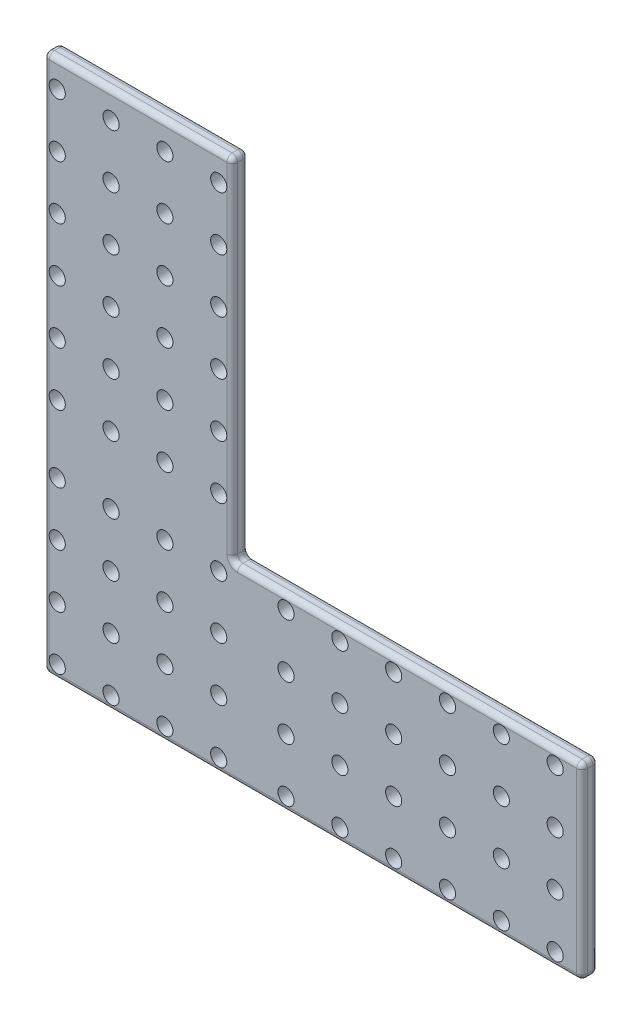
from build123d import *

# Parameters (mm, degrees)
ESQUISSE1_W                        = 100
ESQUISSE1_H                        = 35
BOSS_EXTRU_1_DEPTH                 = 3
ESQUISSE2_R                        = 1.5
ENL_V_MAT_EXTRU_1_DEPTH            = 3
CONG_1_R                           = 1
R_P_TITION_CIRCULAIRE4_COUNT       = 2
R_P_TITION_CIRCULAIRE4_ANGLE       = 90
R_P_TITION_CIRCULAIRE4_2_COUNT     = 2
R_P_TITION_CIRCULAIRE4_2_ANGLE     = 90
CONG_1_OF_R_P_TITION_CIRCULAIRE4_R = 1
ESQUISSE4_R                        = 1.5
ENL_V_MAT_EXTRU_2_DEPTH            = 10
CONG_2_R                           = 1


with BuildPart() as part:
    # Esquisse1 → Boss.-Extru.1 (new body)
    with BuildSketch(Plane.XY):
        with Locations((50, 17.5)):
            Rectangle(ESQUISSE1_W, ESQUISSE1_H)
    boss_extru_1 = extrude(amount=BOSS_EXTRU_1_DEPTH)

    # Esquisse2 → Enlèv. mat.-Extru.1 (cut)
    with BuildSketch(Plane.XY.offset(3)):
        with Locations((95, 32.5)):
            Circle(ESQUISSE2_R)
        with Locations((85, 32.5)):
            Circle(ESQUISSE2_R)
        with Locations((75, 32.5)):
            Circle(ESQUISSE2_R)
        with Locations((65, 32.5)):
            Circle(ESQUISSE2_R)
        with Locations((55, 32.5)):
            Circle(ESQUISSE2_R)
        with Locations((45, 32.5)):
            Circle(ESQUISSE2_R)
        with Locations((85, 22.5)):
            Circle(ESQUISSE2_R)
        with Locations((75, 22.5)):
            Circle(ESQUISSE2_R)
        with Locations((65, 22.5)):
            Circle(ESQUISSE2_R)
        with Locations((55, 22.5)):
            Circle(ESQUISSE2_R)
        with Locations((45, 22.5)):
            Circle(ESQUISSE2_R)
        with Locations((85, 12.5)):
            Circle(ESQUISSE2_R)
        with Locations((75, 12.5)):
            Circle(ESQUISSE2_R)
        with Locations((65, 12.5)):
            Circle(ESQUISSE2_R)
        with Locations((55, 12.5)):
            Circle(ESQUISSE2_R)
        with Locations((45, 12.5)):
            Circle(ESQUISSE2_R)
        with Locations((85, 2.5)):
            Circle(ESQUISSE2_R)
        with Locations((75, 2.5)):
            Circle(ESQUISSE2_R)
        with Locations((65, 2.5)):
            Circle(ESQUISSE2_R)
        with Locations((55, 2.5)):
            Circle(ESQUISSE2_R)
        with Locations((45, 2.5)):
            Circle(ESQUISSE2_R)
        with Locations((95, 22.5)):
            Circle(ESQUISSE2_R)
        with Locations((95, 12.5)):
            Circle(ESQUISSE2_R)
        with Locations((95, 2.5)):
            Circle(ESQUISSE2_R)
    enl_v_mat_extru_1 = extrude(amount=-ENL_V_MAT_EXTRU_1_DEPTH, mode=Mode.SUBTRACT)

    # Congé1
    cong_1_edges = [part.edges().sort_by_distance(p)[0] for p in [
        (0, 35, 1.5),
        (100, 35, 1.5),
        (100, 0, 1.5),
        (0, 0, 1.5),
    ]]
    fillet(cong_1_edges, radius=CONG_1_R)


with BuildPart() as r_p_tition_circulaire4_1:
    # Répétition circulaire4: Boss.-Extru.1 ×2 about axis
    r_p_tition_circulaire4_axis = Axis((17.5, 17.5, 0), (0, 0, 1))
    for i in range(1, R_P_TITION_CIRCULAIRE4_COUNT):
        add(boss_extru_1.rotate(r_p_tition_circulaire4_axis, i * R_P_TITION_CIRCULAIRE4_ANGLE / (R_P_TITION_CIRCULAIRE4_COUNT - 1)))

    # R_p_tition circulaire4 2: Enlèv. mat.-Extru.1 ×2 about axis
    r_p_tition_circulaire4_2_axis = Axis((17.5, 17.5, 0), (0, 0, 1))
    for i in range(1, R_P_TITION_CIRCULAIRE4_2_COUNT):
        add(enl_v_mat_extru_1.rotate(r_p_tition_circulaire4_2_axis, i * R_P_TITION_CIRCULAIRE4_2_ANGLE / (R_P_TITION_CIRCULAIRE4_2_COUNT - 1)), mode=Mode.SUBTRACT)

    # Congé1 of Répétition circulaire4
    cong_1_of_r_p_tition_circulaire4_edges = [r_p_tition_circulaire4_1.edges().sort_by_distance(p)[0] for p in [
        (0, 0, 1.5),
        (0, 100, 1.5),
        (35, 100, 1.5),
        (35, 0, 1.5),
    ]]
    fillet(cong_1_of_r_p_tition_circulaire4_edges, radius=CONG_1_OF_R_P_TITION_CIRCULAIRE4_R)


with BuildPart() as part_1:
    add(part.part)

    # Répétition circulaire4 united with what: union Répétition circulaire4_1
    add(r_p_tition_circulaire4_1.part)

    # Esquisse4 → Enlèv. mat.-Extru.2 (cut)
    with BuildSketch(Plane.XY.offset(3)):
        with Locations((2.5, 2.5)):
            Circle(ESQUISSE4_R)
        with Locations((12.5, 2.5)):
            Circle(ESQUISSE4_R)
        with Locations((22.5, 2.5)):
            Circle(ESQUISSE4_R)
        with Locations((32.5, 2.5)):
            Circle(ESQUISSE4_R)
        with Locations((12.5, 12.5)):
            Circle(ESQUISSE4_R)
        with Locations((22.5, 12.5)):
            Circle(ESQUISSE4_R)
        with Locations((32.5, 12.5)):
            Circle(ESQUISSE4_R)
        with Locations((12.5, 22.5)):
            Circle(ESQUISSE4_R)
        with Locations((22.5, 22.5)):
            Circle(ESQUISSE4_R)
        with Locations((32.5, 22.5)):
            Circle(ESQUISSE4_R)
        with Locations((12.5, 32.5)):
            Circle(ESQUISSE4_R)
        with Locations((22.5, 32.5)):
            Circle(ESQUISSE4_R)
        with Locations((32.5, 32.5)):
            Circle(ESQUISSE4_R)
        with Locations((2.5, 12.5)):
            Circle(ESQUISSE4_R)
        with Locations((2.5, 22.5)):
            Circle(ESQUISSE4_R)
        with Locations((2.5, 32.5)):
            Circle(ESQUISSE4_R)
    extrude(amount=-ENL_V_MAT_EXTRU_2_DEPTH, mode=Mode.SUBTRACT)

    # Congé2
    cong_2_edges = [part_1.edges().sort_by_distance(p)[0] for p in [
        (67, 35, 0),
        (100, 17.5, 0),
        (99.707106781, 34.707106781, 0),
        (99.707106781, 0.292893219, 0),
        (67, 35, 3),
        (100, 17.5, 3),
        (99.707106781, 34.707106781, 3),
        (99.707106781, 0.292893219, 3),
        (35, 35, 1.5),
        (35, 67, 0),
        (35, 67, 3),
        (50, 0, 0),
        (50, 0, 3),
        (0, 50, 0),
        (17.5, 100, 0),
        (0.292893219, 99.707106781, 0),
        (34.707106781, 99.707106781, 0),
        (0.292893219, 0.292893219, 0),
        (0, 50, 3),
        (17.5, 100, 3),
        (0.292893219, 99.707106781, 3),
        (34.707106781, 99.707106781, 3),
        (0.292893219, 0.292893219, 3),
    ]]
    fillet(cong_2_edges, radius=CONG_2_R - 0.0001)  # a hair under: the kernel refuses the full size


solid = part_1.part
